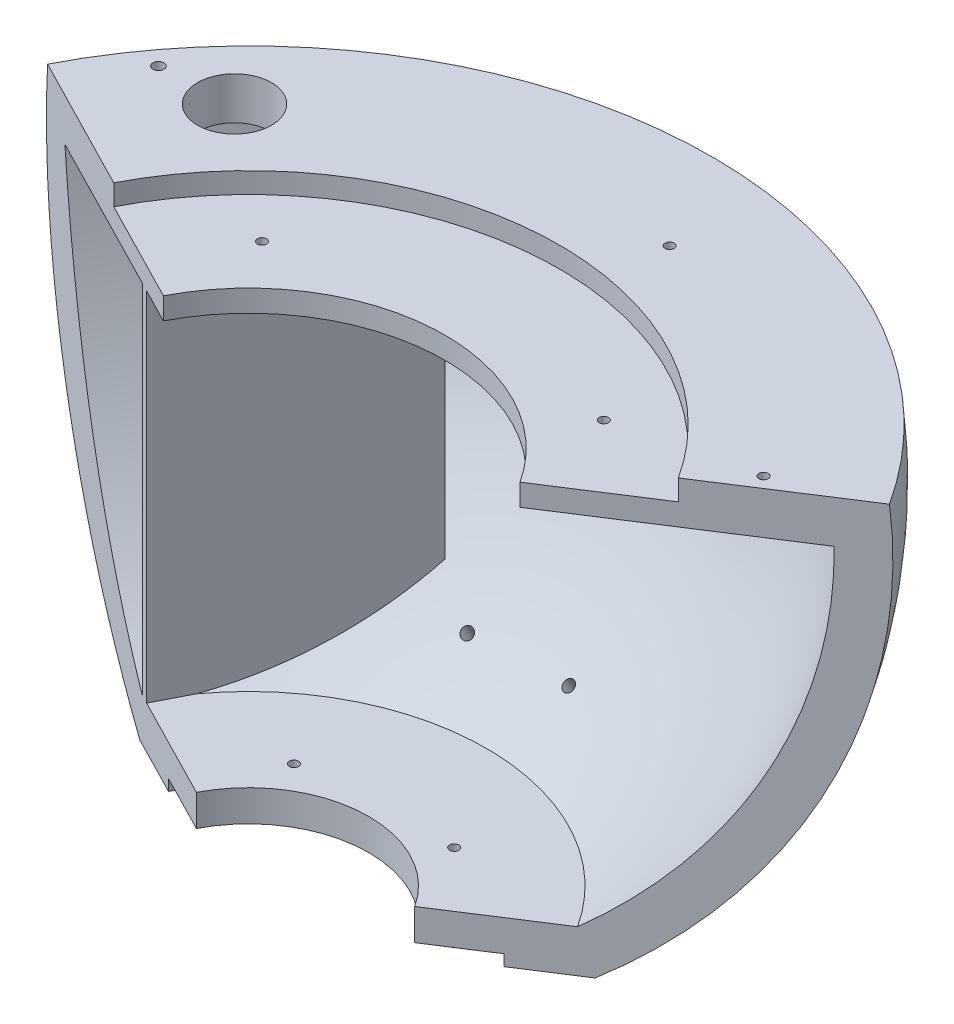
from build123d import *

# Parameters (mm, degrees)
ENL_V_MAT_EXTRU_1_DEPTH  = 205
ESQUISSE4_W              = 219.672698512
ESQUISSE4_H              = 187
ENL_V_MAT_EXTRU_2_DEPTH  = 241.082722882
COQUE2_T                 = -10
ENL_V_MAT_EXTRU_4_DEPTH  = 5
ENL_V_MAT_EXTRU_5_DEPTH  = 25
ENL_V_MAT_EXTRU_6_DEPTH  = 2.5
ENL_V_MAT_EXTRU_10_DEPTH = 15
ECHELLE1_SCALE           = 1.15
ESQUISSE21_W             = 51
ESQUISSE21_H             = 96.6
BOSS_EXTRU_2_DEPTH       = 60
ESQUISSE12_W             = 13
ESQUISSE12_H             = 18.7
ENL_V_MAT_EXTRU_12_DEPTH = 50
ESQUISSE13_R             = 2.75
ENL_V_MAT_EXTRU_13_DEPTH = 50
ESQUISSE14_R             = 3.25
ENL_V_MAT_EXTRU_14_DEPTH = 42
ESQUISSE15_W             = 15
ESQUISSE15_H             = 21
ENL_V_MAT_EXTRU_15_DEPTH = 6.5
ENL_V_MAT_EXTRU_16_DEPTH = 50
ESQUISSE24_R             = 10
ENL_V_MAT_EXTRU_17_DEPTH = 20
TROU_TARAUD_M31_D        = 2.5
TROU_TARAUD_M31_DEPTH    = 12.5
TROU_TARAUD_M31_TIP      = 0.751075774
TROU_TARAUD_M32_D        = 2.5
TROU_TARAUD_M32_DEPTH    = 12.5
TROU_TARAUD_M32_TIP      = 0.751075774
TROU_TARAUD_M34_D        = 2.5
TROU_TARAUD_M34_DEPTH    = 12.5
TROU_TARAUD_M34_TIP      = 0.751075774
ESQUISSE34_R             = 1.5
ENL_V_MAT_EXTRU_18_DEPTH = 50
ESQUISSE35_R             = 4.7
ENL_V_MAT_EXTRU_19_DEPTH = 100
ESQUISSE36_R             = 1.5
ENL_V_MAT_EXTRU_20_DEPTH = 40


with BuildPart() as part:
    # Esquisse1 → Révolution2 (revolve)
    with BuildSketch(Plane.XY):
        with BuildLine():
            Line((0.334149559, -92.625367455), (0.334149559, 171))
            ThreePointArc((0.334149559, 171), (43.341663836, 173.345331392), (83, 190.148998741))
            ThreePointArc((83, 190.148998741), (97.133928161, 161.990328143), (102, 130.86156331))
            add(Edge.make_bspline(
                [(102, 130.86156331), (103.479009077, 113.684745488), (71.205293421, 65.560678141), (110.707376512, 34.252457406), (109.358599643, 11.86156331)],
                knots=[0, 0, 0, 0, 0.406612523, 1, 1, 1, 1], degree=3))
            ThreePointArc((109.358599643, 11.86156331), (99.215374733, -47.500625433), (59.334149559, -92.625367455))
            Line((59.334149559, -92.625367455), (0.334149559, -92.625367455))
        make_face()
    revolve(axis=Axis((0.334149559, -92.625367455, 0), (0, 1, 0)))

    # Esquisse3 → Enlèv. mat.-Extru.1 (cut, symmetric)
    with BuildSketch(Plane(origin=(0, 0, 0), x_dir=(1, 0, 0), z_dir=(0, 1, 0))):
        with BuildLine():
            Line((-97.244399695, 50.050229554), (0.334149559, 0))
            Line((0.334149559, 0), (92.468194445, 59.480387742))
            ThreePointArc((92.468194445, 59.480387742), (5.778653928, -109.530617295), (-97.244399695, 50.050229554))
        make_face()
    extrude(amount=ENL_V_MAT_EXTRU_1_DEPTH, both=True, mode=Mode.SUBTRACT)

    # Esquisse4 → Enlèv. mat.-Extru.2 (cut, through all)
    with BuildSketch(Plane.XY):
        with Locations((-2.163650744, 104.874632545)):
            Rectangle(ESQUISSE4_W, ESQUISSE4_H)
    extrude(amount=-ENL_V_MAT_EXTRU_2_DEPTH, mode=Mode.SUBTRACT)

    # Coque2
    coque2_openings = [part.faces().sort_by_distance(p)[0] for p in [
        (41.688799169, -36.484898267, -26.697955102),
        (-43.464282683, -36.484897866, -22.465199622),
    ]]
    offset(amount=COQUE2_T, openings=coque2_openings, kind=Kind.INTERSECTION)

    # Esquisse6 → Enlèv. mat.-Extru.4 (cut)
    with BuildSketch(Plane(origin=(0, 11.5, 0), x_dir=(1, 0, 0), z_dir=(0, 1, 0))):
        with BuildLine():
            Line((-64.751451353, 33.383866548), (0.334149559, 0))
            Line((0.334149559, 0), (61.788226523, 39.673850536))
            ThreePointArc((61.788226523, 39.673850536), (-3.29737439, 73.057717085), (-64.751451353, 33.383866548))
        make_face()
    extrude(amount=-ENL_V_MAT_EXTRU_4_DEPTH, mode=Mode.SUBTRACT)

    # Esquisse7 → Enlèv. mat.-Extru.5 (cut)
    with BuildSketch(Plane(origin=(0, 11.5, 0), x_dir=(1, 0, 0), z_dir=(0, 1, 0))):
        with BuildLine():
            Line((-40.77485255, 21.085730501), (0.334149559, 0))
            Line((0.334149559, 0), (39.149428885, 25.0585749))
            ThreePointArc((39.149428885, 25.0585749), (-1.959573224, 46.144305401), (-40.77485255, 21.085730501))
        make_face()
    extrude(amount=-ENL_V_MAT_EXTRU_5_DEPTH, mode=Mode.SUBTRACT)

    # Esquisse8 → Enlèv. mat.-Extru.6 (cut, symmetric)
    with BuildSketch(Plane(origin=(0, -92.5, 0), x_dir=(1, 0, 0), z_dir=(0, 1, 0))):
        with BuildLine():
            Line((36.828161908, 23.559998993), (0.334149559, 0))
            Line((0.334149559, 0), (-38.316414256, 19.824742283))
            ThreePointArc((-38.316414256, 19.824742283), (-1.822401908, 43.384741276), (36.828161908, 23.559998993))
        make_face()
    extrude(amount=ENL_V_MAT_EXTRU_6_DEPTH, both=True, mode=Mode.SUBTRACT)

    # Esquisse10 → Enlèv. mat.-Extru.10 (cut)
    with BuildSketch(Plane(origin=(0, -92.5, 0), x_dir=(1, 0, 0), z_dir=(0, 1, 0))):
        with BuildLine():
            Line((-24.838107184, 12.911415859), (0.334149559, 0))
            Line((0.334149559, 0), (24.101892064, 15.344105881))
            ThreePointArc((24.101892064, 15.344105881), (-1.070364679, 28.25552174), (-24.838107184, 12.911415859))
        make_face()
    extrude(amount=ENL_V_MAT_EXTRU_10_DEPTH, mode=Mode.SUBTRACT)


with BuildPart() as part_1:
    # Echelle1: scaled about (-3.205200526, -32.621069623, -71.20331532)
    add(part.part.scale(ECHELLE1_SCALE).moved(Location((0.480780079, 4.893160443, 10.680497298))))


with BuildPart() as boss_extru_2_tool:
    # Esquisse21 → Boss.-Extru.2 (new body)
    with BuildSketch(Plane(origin=(-4.157014741, 0, 8.104567576), x_dir=(0.8897806278064669, 0, 0.45638846871971867), z_dir=(-0.45638846871971867, 0, 0.8897806278064669))):
        with Locations((-83.460699932, -41.826011243)):
            Rectangle(ESQUISSE21_W, ESQUISSE21_H)
    extrude(amount=-BOSS_EXTRU_2_DEPTH)


with BuildPart() as part_2:
    add(part_1.part)


with BuildPart() as part_3:
    # Boss.-Extru.2: joined with boss_extru_2_tool
    add(part_2.part.fuse(boss_extru_2_tool.part, tol=0.00001))

    # Esquisse22 → Enlèvement de matière-Révolution1 (revolve, cut)
    with BuildSketch(Plane(origin=(-4.157014741, 0, 8.104567576), x_dir=(0.8897806278064669, 0, 0.45638846871971867), z_dir=(-0.45638846871971867, 0, 0.8897806278064669))):
        with BuildLine():
            Line((-62.205837722, -101.626011243), (-148.188611207, -101.626011243))
            Line((-148.188611207, -101.626011243), (-148.188611207, 17.973988757))
            Line((-148.188611207, 17.973988757), (-119.79343169, 17.973988757))
            ThreePointArc((-119.79343169, 17.973988757), (-118.791560418, -15.654805135), (-108.960699932, -47.830163825))
            ThreePointArc((-108.960699932, -47.830163825), (-89.450371987, -78.089050955), (-62.205837722, -101.626011243))
        make_face()
    revolve(axis=Axis((1.206969289, 27.593959586, 10.855875462), (0, -1, 0)), mode=Mode.SUBTRACT)

    # Esquisse12 → Enlèv. mat.-Extru.12 (cut)
    with BuildSketch(Plane(origin=(-78.878679002, 0, -90.227888481), x_dir=(-0.7528690703965619, 0, 0.6581703144629183), z_dir=(-0.6581703144629183, 0, -0.752869070396562))):
        with Locations((3.204033394, -8.144947667)):
            Rectangle(ESQUISSE12_W, ESQUISSE12_H)
    extrude(amount=-ENL_V_MAT_EXTRU_12_DEPTH, mode=Mode.SUBTRACT)

    # Esquisse13 → Enlèv. mat.-Extru.13 (cut)
    with BuildSketch(Plane(origin=(-78.878679002, 0, -90.227888481), x_dir=(-0.7528690703965619, 0, 0.6581703144629183), z_dir=(-0.6581703144629183, 0, -0.752869070396562))):
        with Locations((2.989966853, -80.5)):
            Circle(ESQUISSE13_R)
    extrude(amount=-ENL_V_MAT_EXTRU_13_DEPTH, mode=Mode.SUBTRACT)

    # Esquisse14 → Enlèv. mat.-Extru.14 (cut)
    with BuildSketch(Plane(origin=(-78.878679002, 0, -90.227888481), x_dir=(-0.7528690703965619, 0, 0.6581703144629183), z_dir=(-0.6581703144629183, 0, -0.752869070396562))):
        with Locations((2.989966853, -80.5)):
            Circle(ESQUISSE14_R)
    extrude(amount=-ENL_V_MAT_EXTRU_14_DEPTH, mode=Mode.SUBTRACT)

    # Esquisse15 → Enlèv. mat.-Extru.15 (cut)
    with BuildSketch(Plane(origin=(-78.878679002, 0, -90.227888481), x_dir=(-0.7528690703965619, 0, 0.6581703144629183), z_dir=(-0.6581703144629183, 0, -0.752869070396562))):
        with Locations((3.251709965, -8.202448725)):
            Rectangle(ESQUISSE15_W, ESQUISSE15_H)
    extrude(amount=-ENL_V_MAT_EXTRU_15_DEPTH, mode=Mode.SUBTRACT)

    # Esquisse23 → Enlèv. mat.-Extru.16 (cut)
    with BuildSketch(Plane(origin=(-4.157014741, 0, 8.104567576), x_dir=(0.8897806278064669, 0, 0.45638846871971867), z_dir=(-0.45638846871971867, 0, 0.8897806278064669))):
        with BuildLine():
            Line((-60.544912293, -90.157417802), (-60.544912293, -74.501923386))
            Line((-60.544912293, -74.501923386), (-60.544912293, 6.473988757))
            Line((-60.544912293, 6.473988757), (-108.960699932, 6.473988757))
            add(Edge.make_bspline(
                [(-108.960699932, 6.473988757), (-103.08466941, -29.155032321), (-88.705915262, -66.42377152), (-60.600321602, -90.157417802)],
                knots=[0, 0, 0, 0, 1, 1, 1, 1], degree=3))
            Line((-60.600321602, -90.157417802), (-60.544912293, -90.157417802))
        make_face()
    extrude(amount=-ENL_V_MAT_EXTRU_16_DEPTH, mode=Mode.SUBTRACT)

    # Esquisse24 → Enlèv. mat.-Extru.17 (cut)
    with BuildSketch(Plane(origin=(0, 17.973988757, 0), x_dir=(1, 0, 0), z_dir=(0, 1, 0))):
        with Locations((-76.134948486, 62.530707007)):
            Circle(ESQUISSE24_R)
    extrude(amount=-ENL_V_MAT_EXTRU_17_DEPTH, mode=Mode.SUBTRACT)

    # Trou taraudé M31
    with Locations(Plane(origin=(0, -98.60683867, 0), x_dir=(-1, 0, 0), z_dir=(0, -1, 0))):
        with Locations((21.564432755, 24.05170562), (-19.739570816, 26.104828604)):
            Hole(TROU_TARAUD_M31_D / 2, depth=TROU_TARAUD_M31_DEPTH)
            with Locations((0, 0, -(TROU_TARAUD_M31_DEPTH + TROU_TARAUD_M31_TIP / 2))):  # 118° drill point
                Cone(0, TROU_TARAUD_M31_D / 2, TROU_TARAUD_M31_TIP, mode=Mode.SUBTRACT)

    # Trou taraudé M32
    with Locations(Plane(origin=(-45.802285112, 12.36816133, -39.635090601), x_dir=(0, 0, 1), z_dir=(0, 1, 0))):
        with Locations((0, 0), (-4.379976461, 88.114820569)):
            Hole(TROU_TARAUD_M32_D / 2, depth=TROU_TARAUD_M32_DEPTH)
            with Locations((0, 0, -(TROU_TARAUD_M32_DEPTH + TROU_TARAUD_M32_TIP / 2))):  # 118° drill point
                Cone(0, TROU_TARAUD_M32_D / 2, TROU_TARAUD_M32_TIP, mode=Mode.SUBTRACT)

    # Trou taraudé M34
    with Locations(Plane(origin=(15.973929022, 17.973988757, -88.171521655), x_dir=(1, 0, 0), z_dir=(0, 1, 0))):
        with Locations((0, 0), (66.643688155, -41.262802003)):
            Hole(TROU_TARAUD_M34_D / 2, depth=TROU_TARAUD_M34_DEPTH)
            with Locations((0, 0, -(TROU_TARAUD_M34_DEPTH + TROU_TARAUD_M34_TIP / 2))):  # 118° drill point
                Cone(0, TROU_TARAUD_M34_D / 2, TROU_TARAUD_M34_TIP, mode=Mode.SUBTRACT)

    # Esquisse34 → Enlèv. mat.-Extru.18 (cut, symmetric)
    with BuildSketch(Plane(origin=(0, 7.973988757, 0), x_dir=(1, 0, 0), z_dir=(0, 1, 0))):
        with Locations((-95.301732953, 61.123056011)):
            Circle(ESQUISSE34_R)
    extrude(amount=ENL_V_MAT_EXTRU_18_DEPTH, both=True, mode=Mode.SUBTRACT)

    # Esquisse35 → Enlèv. mat.-Extru.19 (cut)
    with BuildSketch(Plane(origin=(0, 7.973988757, 0), x_dir=(1, 0, 0), z_dir=(0, 1, 0))):
        with Locations((-95.301732953, 61.123056011)):
            Circle(ESQUISSE35_R)
    extrude(amount=-ENL_V_MAT_EXTRU_19_DEPTH, mode=Mode.SUBTRACT)

    # Esquisse36 → Enlèv. mat.-Extru.20 (cut)
    with BuildSketch(Plane(origin=(-3.81347991, -103.808757135, -59.488432055), x_dir=(0.999492440639361, -0.02764010082978665, -0.015839379119540354), z_dir=(0.03185688473114256, 0.8671931380306902, 0.4969519093913527))):
        with Locations((12.280305924, 19.835880603)):
            Circle(ESQUISSE36_R)
        with Locations((-13.688984931, 18.57257839)):
            Circle(ESQUISSE36_R)
    extrude(amount=ENL_V_MAT_EXTRU_20_DEPTH, mode=Mode.SUBTRACT)


solid = part_3.part
